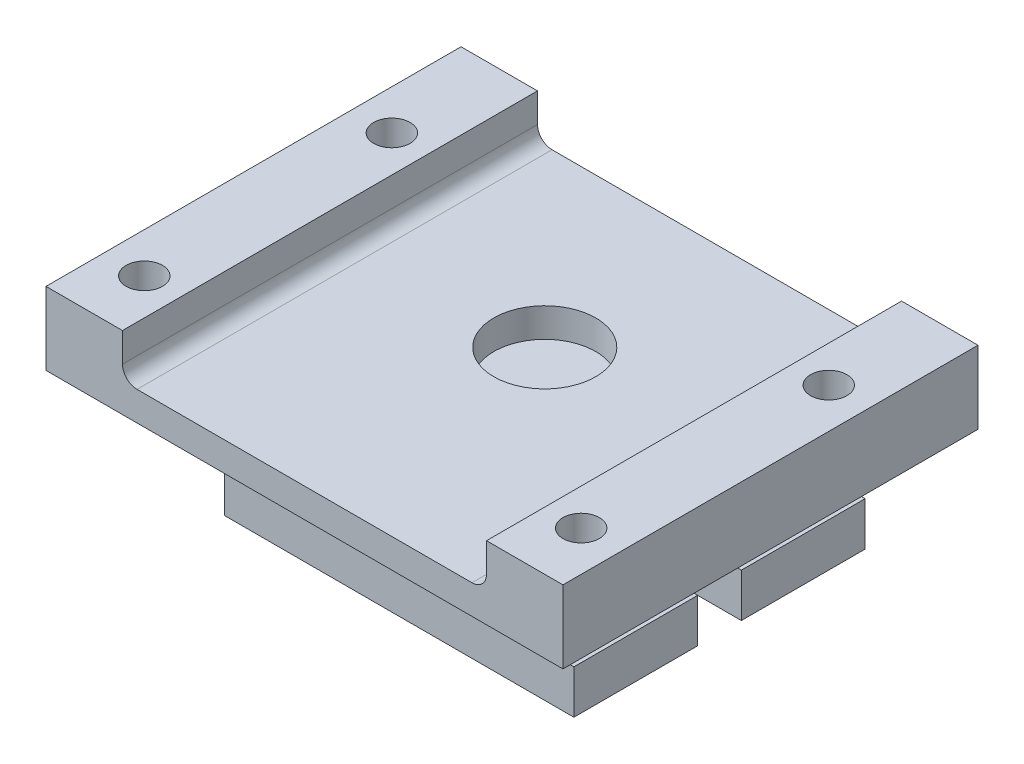
from build123d import *

# Parameters (mm, degrees)
SKETCH1_W               = 35.5
SKETCH1_H               = 28.5
SKETCH1_R               = 1.25
BOSS_EXTRUDE1_DEPTH     = 5
SKETCH2_W               = 25
SKETCH2_H               = 28.5
SKETCH2_R               = 3.5
CUT_EXTRUDE1_DEPTH      = 3
CUT_EXTRUDE2_DEPTH      = 25.74494898
CUT_EXTRUDE2_DEPTH_BACK = 25.74494898
SKETCH3_R               = 3.5
FILLET1_R               = 1
SKETCH4_W               = 30
SKETCH4_H               = 20
BOSS_EXTRUDE5_DEPTH     = 9
CUT_EXTRUDE7_DEPTH      = 34.14079812
CUT_EXTRUDE7_DEPTH_BACK = 34.14079812
CUT_EXTRUDE8_DEPTH      = 36.189664676
CUT_EXTRUDE8_DEPTH_BACK = 36.189664676
SKETCH8_W               = 3
SKETCH8_H               = 3
FILLET2_R               = 2


with BuildPart() as part:
    # Sketch1 → Boss-Extrude1 (new body)
    with BuildSketch(Plane(origin=(0, 0, 0), x_dir=(1, 0, 0), z_dir=(0, 1, 0))):
        with Locations((0, -2.25)):
            Rectangle(SKETCH1_W, SKETCH1_H)
        with Locations(Location((-15, 4.5, 0), (0, 0, 270))):
            Circle(SKETCH1_R, mode=Mode.SUBTRACT)
        with Locations(Location((15, 4.5, 0), (0, 0, 270))):
            Circle(SKETCH1_R, mode=Mode.SUBTRACT)
        with Locations(Location((-15, -12.5, 0), (0, 0, 270))):
            Circle(SKETCH1_R, mode=Mode.SUBTRACT)
        with Locations(Location((15, -12.5, 0), (0, 0, 270))):
            Circle(SKETCH1_R, mode=Mode.SUBTRACT)
    extrude(amount=BOSS_EXTRUDE1_DEPTH)

    # Sketch2 → Cut-Extrude1 (cut)
    with BuildSketch(Plane(origin=(0, 5, 0), x_dir=(1, 0, 0), z_dir=(0, 1, 0))):
        with Locations((0, -2.25)):
            Rectangle(SKETCH2_W, SKETCH2_H)
        with Locations(Location((0, 0, 0), (0, 0, 270))):
            Circle(SKETCH2_R, mode=Mode.SUBTRACT)
    extrude(amount=-CUT_EXTRUDE1_DEPTH, mode=Mode.SUBTRACT)

    # Sketch3 → Cut-Extrude2 (cut, two sides: drawn at the far end of the back side and taken through both)
    with BuildSketch(Plane(origin=(0, 5, 0), x_dir=(1, 0, 0), z_dir=(0, 1, 0)).offset(-CUT_EXTRUDE2_DEPTH_BACK)):
        with Locations(Location((0, 0, 0), (0, 0, 270))):
            Circle(SKETCH3_R)
    extrude(amount=CUT_EXTRUDE2_DEPTH + CUT_EXTRUDE2_DEPTH_BACK, mode=Mode.SUBTRACT)

    # Fillet1
    fillet1_edges = [part.edges().sort_by_distance(p)[0] for p in [
        (12.5, 2, 2.25),
        (-12.5, 2, 2.25),
    ]]
    fillet(fillet1_edges, radius=FILLET1_R)

    # Sketch4 → Boss-Extrude5 (add)
    with BuildSketch(Plane.XZ):
        Rectangle(SKETCH4_W, SKETCH4_H)
    extrude(amount=BOSS_EXTRUDE5_DEPTH)

    # Sketch7 → Cut-Extrude7 (cut, two sides: drawn at the far end of the back side and taken through both)
    with BuildSketch(Plane(origin=(0, 0, -10), x_dir=(-1, 0, 0), z_dir=(0, 0, -1)).offset(-CUT_EXTRUDE7_DEPTH_BACK)):
        Polygon((12, -6), (12, -9), (15, -9), (15, 0), (9, 0), (9, -6), align=None)
        Polygon((-15, -9), (-12, -9), (-12, -6), (-9, -6), (-9, 0), (-15, 0), align=None)
    extrude(amount=CUT_EXTRUDE7_DEPTH + CUT_EXTRUDE7_DEPTH_BACK, mode=Mode.SUBTRACT)

    # Sketch8 → Cut-Extrude8 (cut, two sides: drawn at the far end of the back side and taken through both)
    with BuildSketch(Plane.ZY.offset(12).offset(-CUT_EXTRUDE8_DEPTH_BACK)):
        with Locations((0, -7.5)):
            Rectangle(SKETCH8_W, SKETCH8_H)
    extrude(amount=CUT_EXTRUDE8_DEPTH + CUT_EXTRUDE8_DEPTH_BACK, mode=Mode.SUBTRACT)

    # Fillet2
    # the kernel refuses this fillet: 2 mm, written as the material it adds along each edge
    with BuildSketch(Plane(origin=(9, 0, -10), x_dir=(1, 0, 0), z_dir=(0, 0, 1))) as fillet2_piece_1:
        with BuildLine():
            CenterArc((FILLET2_R, -FILLET2_R), FILLET2_R, 90, 90)
            Line((0, -FILLET2_R), (0, 0))
            Line((0, 0), (FILLET2_R, 0))
        make_face()
    extrude(amount=20)
    with BuildSketch(Plane(origin=(-9, 0, -10), x_dir=(-1, 0, 0), z_dir=(0, 0, 1))) as fillet2_piece_2:
        with BuildLine():
            CenterArc((FILLET2_R, FILLET2_R), FILLET2_R, 180, 90)
            Line((0, FILLET2_R), (0, 0))
            Line((0, 0), (FILLET2_R, 0))
        make_face()
    extrude(amount=20)
    with BuildSketch(Plane(origin=(-9, -6, -1.5), x_dir=(0, 0, 1), z_dir=(1, 0, 0)), Plane(origin=(9, -6, 1.5), x_dir=(0, 0, -1), z_dir=(-1, 0, 0))) as fillet2_piece_3:
        with BuildLine():
            CenterArc((FILLET2_R, FILLET2_R), FILLET2_R, 180, 90)
            Line((0, FILLET2_R), (0, 0))
            Line((0, 0), (FILLET2_R, 0))
        make_face()
    extrude(amount=18)


solid = part.part
